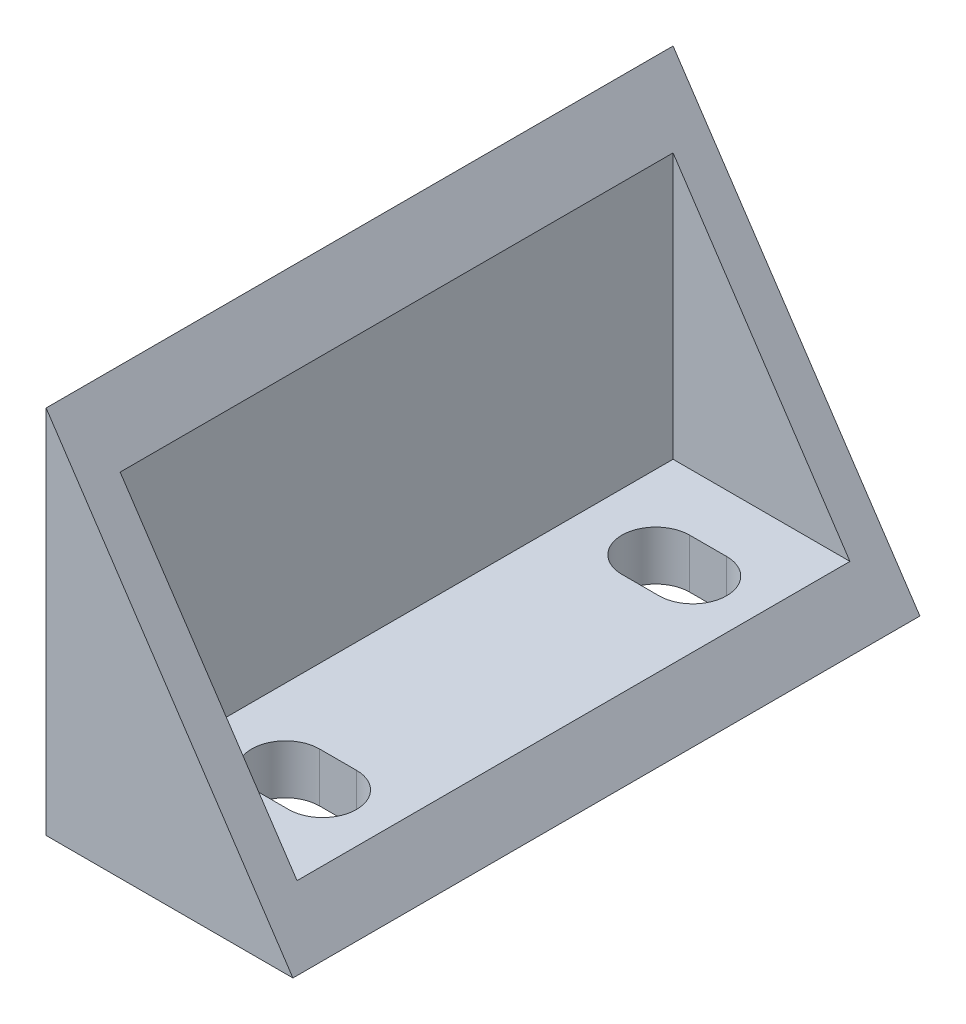
from build123d import *

# Parameters (mm, degrees)
BOSS_EXTRUDE1_DEPTH      = 25.4
SKETCH3_W                = 17
SKETCH3_H                = 44.8
CUT_EXTRUDE1_DEPTH       = 26
M5_CLEARANCE_SLOT1_DEPTH = 4


# Read off the part's stored shape, not the designer's step: M5 Clearance Slot1
with BuildPart() as part:
    # Sketch2 → Boss-Extrude1 (new, symmetric)
    with BuildSketch(Plane.XY):
        Polygon((0, 0), (0, 30), (20, 0), align=None)
    extrude(amount=BOSS_EXTRUDE1_DEPTH, both=True)

    # Sketch3 → Cut-Extrude1 (cut)
    with BuildSketch(Plane(origin=(0, 30, 0), x_dir=(1, 0, 0), z_dir=(0, 1, 0))):
        with Locations((11.5, 0)):
            Rectangle(SKETCH3_W, SKETCH3_H)
    extrude(amount=-CUT_EXTRUDE1_DEPTH, mode=Mode.SUBTRACT)

    # M5 Clearance Slot1 outline → M5 Clearance Slot1 (cut)
    with BuildSketch(Plane(origin=(0, 0, 0), x_dir=(1, 0, 0), z_dir=(0, 1, 0))):
        with BuildLine():
            Line((9, 12.25), (12, 12.25))
            ThreePointArc((12, 12.25), (14.75, 15), (12, 17.75))
            Line((12, 17.75), (9, 17.75))
            ThreePointArc((9, 17.75), (6.25, 15), (9, 12.25))
        make_face()
        with BuildLine():
            Line((9, -17.75), (12, -17.75))
            ThreePointArc((12, -17.75), (14.75, -15), (12, -12.25))
            Line((12, -12.25), (9, -12.25))
            ThreePointArc((9, -12.25), (6.25, -15), (9, -17.75))
        make_face()
    extrude(amount=M5_CLEARANCE_SLOT1_DEPTH, mode=Mode.SUBTRACT)


solid = part.part
